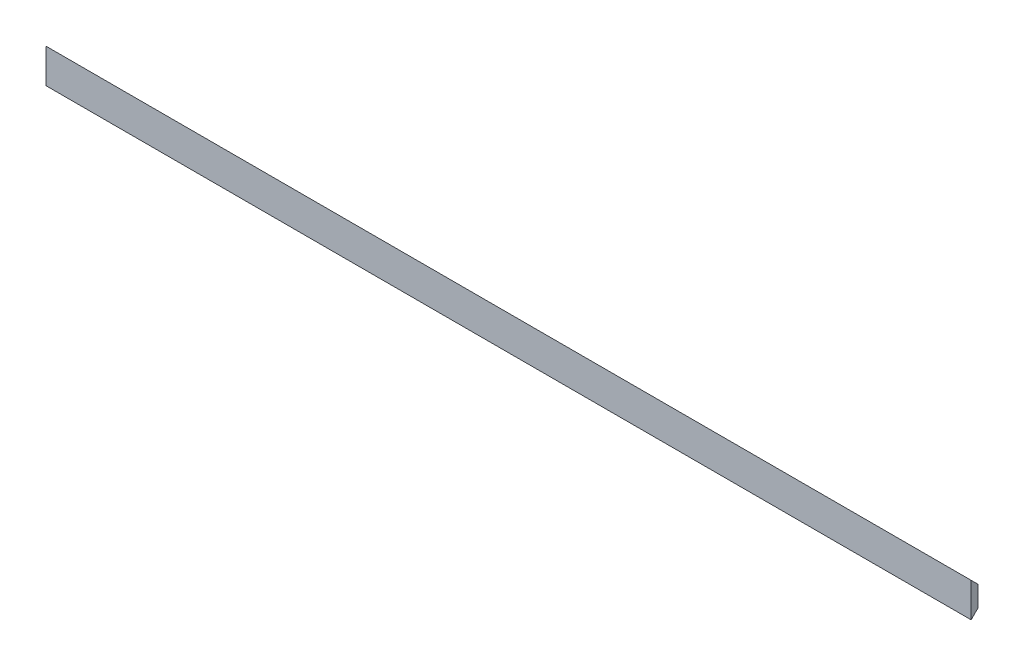
from build123d import *

# Parameters (mm, degrees)
ESBO_O2_W                = 2700
ESBO_O2_H                = 100
RESSALTO_EXTRUS_O1_DEPTH = 20
CHANFRO1_SIZE            = 20


with BuildPart() as part:
    # Esboço2 → Ressalto-extrusão1 (new body)
    with BuildSketch(Plane.XY):
        with Locations((1350, 50)):
            Rectangle(ESBO_O2_W, ESBO_O2_H)
    extrude(amount=RESSALTO_EXTRUS_O1_DEPTH)

    # Chanfro1
    chanfro1_edges = [part.edges().sort_by_distance(p)[0] for p in [
        (1350, 0, 0),
        (1350, 100, 0),
    ]]
    chamfer(chanfro1_edges, length=CHANFRO1_SIZE - 0.0001)  # a hair under: the kernel refuses the full size


solid = part.part
